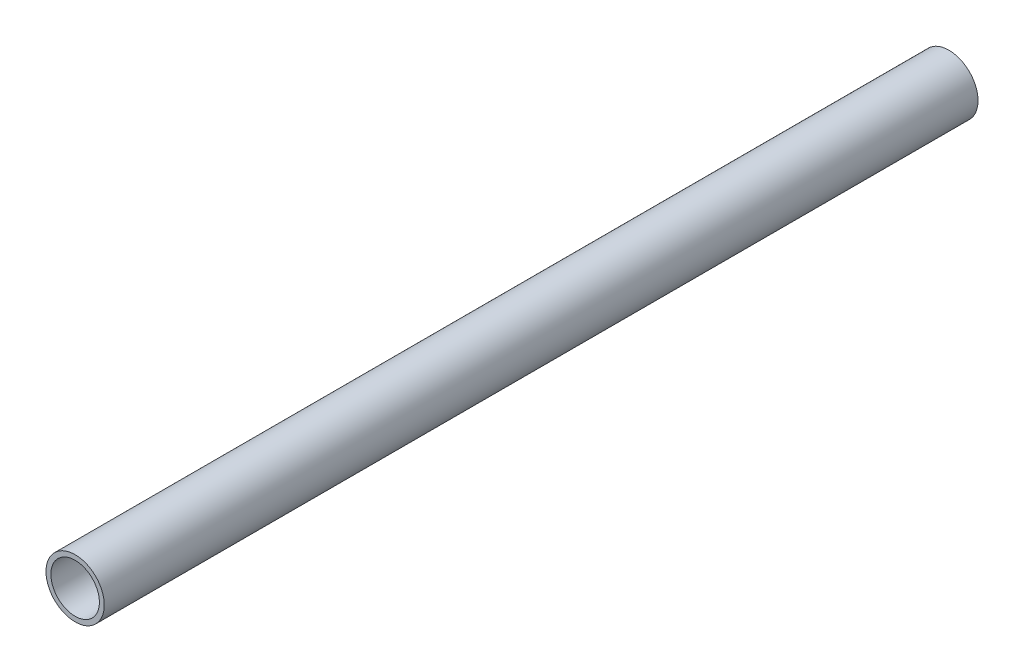
from build123d import *

# Parameters (mm, degrees)
CROQUIS1_R              = 6
CROQUIS1_R_2            = 5
SALIENTE_EXTRUIR1_DEPTH = 90


with BuildPart() as part:
    # Croquis1 → Saliente-Extruir1 (new, symmetric)
    with BuildSketch(Plane.XY):
        Circle(CROQUIS1_R)
        Circle(CROQUIS1_R_2, mode=Mode.SUBTRACT)
    extrude(amount=SALIENTE_EXTRUIR1_DEPTH, both=True)


solid = part.part
